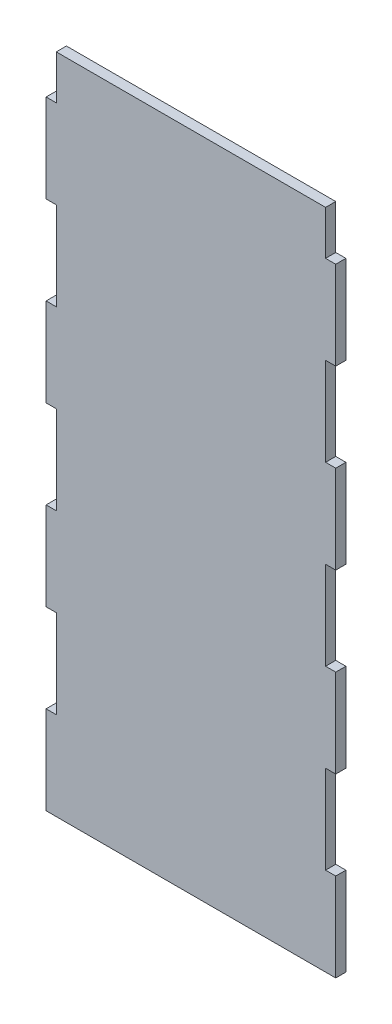
from build123d import *

# Parameters (mm, degrees)
SKETCH1_W           = 83.312
SKETCH1_H           = 190.5
BOSS_EXTRUDE1_DEPTH = 1.4605
SKETCH2_W           = 2.921
SKETCH2_H           = 25.4
SKETCH2_H_2         = 12.7
CUT_EXTRUDE1_DEPTH  = 2.921


with BuildPart() as part:
    # Sketch1 → Boss-Extrude1 (new, symmetric)
    with BuildSketch(Plane.XY):
        Rectangle(SKETCH1_W, SKETCH1_H)
    extrude(amount=BOSS_EXTRUDE1_DEPTH, both=True)

    # Sketch2 → Cut-Extrude1 (cut)
    with BuildSketch(Plane.XY.offset(1.4605)):
        with Locations((-40.1955, -57.15)):
            Rectangle(SKETCH2_W, SKETCH2_H)
        with Locations((40.1955, -57.15)):
            Rectangle(SKETCH2_W, SKETCH2_H)
        with Locations((-40.1955, -6.35)):
            Rectangle(SKETCH2_W, SKETCH2_H)
        with Locations((40.1955, -6.35)):
            Rectangle(SKETCH2_W, SKETCH2_H)
        with Locations((-40.1955, 44.45)):
            Rectangle(SKETCH2_W, SKETCH2_H)
        with Locations((40.1955, 44.45)):
            Rectangle(SKETCH2_W, SKETCH2_H)
        with Locations((-40.1955, 88.9)):
            Rectangle(SKETCH2_W, SKETCH2_H_2)
        with Locations((40.1955, 88.9)):
            Rectangle(SKETCH2_W, SKETCH2_H_2)
    extrude(amount=-CUT_EXTRUDE1_DEPTH, mode=Mode.SUBTRACT)


solid = part.part
